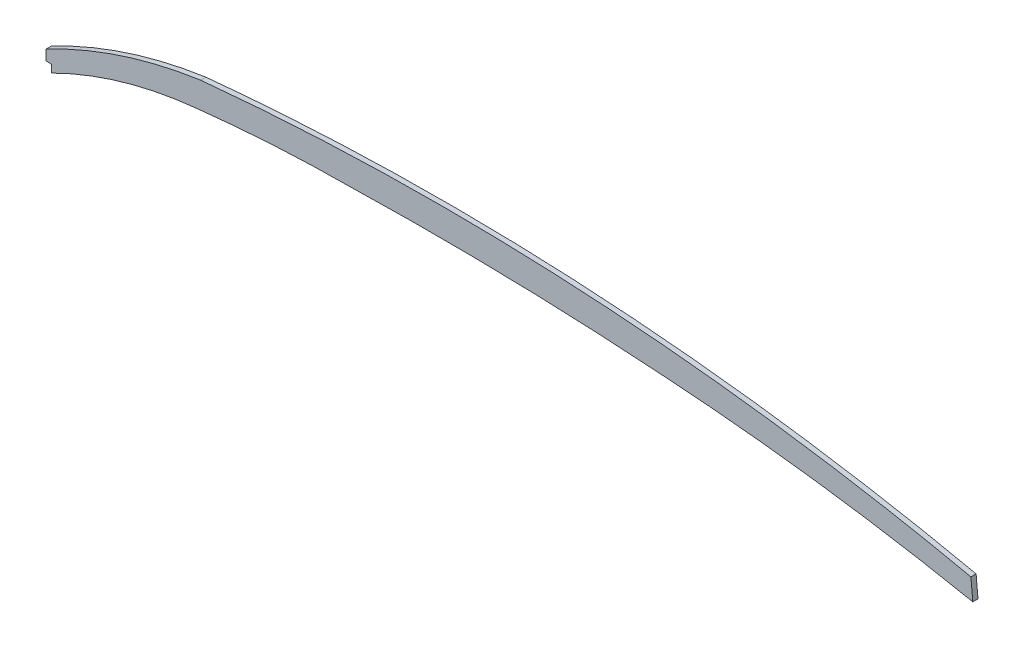
from build123d import *

# Parameters (mm, degrees)
BOSS_EXTRUDE1_DEPTH = 1.5875
SKETCH2_W           = 3.3528
SKETCH2_H           = 6.4262
CUT_EXTRUDE1_DEPTH  = 583.351362494


with BuildPart() as part:
    # Sketch1 → Boss-Extrude1 (new, symmetric)
    with BuildSketch(Plane.XY):
        with BuildLine():
            Line((0, 98.650251409), (0, 85.942482804))
            ThreePointArc((0, 85.942482804), (44.883725347, 104.075777355), (92.3925, 113.364561093))
            ThreePointArc((92.3925, 113.364561093), (139.073495573, 117.280297245), (185.895946704, 118.731643998))
            ThreePointArc((185.895946704, 118.731643998), (279.546572247, 118.92726657), (373.101055052, 114.68030529))
            ThreePointArc((373.101055052, 114.68030529), (470.024153779, 105.277769076), (566.085246422, 89.31652744))
            Line((566.085246422, 89.31652744), (564.932089986, 101.967475673))
            add(Edge.make_bspline(
                [(564.932089986, 101.967475673), (526.305455218, 110.35905311), (487.405693808, 117.234860687), (438.439550099, 123.934721128), (428.624759847, 125.180263294), (408.998984047, 127.476820047), (399.18472115, 128.528373058), (369.737829992, 131.394440576), (350.101100844, 132.920474645), (291.174630327, 136.353130053), (251.868630305, 137.116022476), (173.213311456, 135.594508668), (133.863993721, 133.310179259), (94.492645692, 129.476109839)],
                knots=[0, 0, 0, 0, 0.25, 0.25, 0.3125, 0.3125, 0.375, 0.375, 0.5, 0.5, 0.75, 0.75, 1, 1, 1, 1], degree=3))
            ThreePointArc((94.492645692, 129.476109839), (45.925545315, 118.111851759), (0, 98.650251409))
        make_face()
    extrude(amount=BOSS_EXTRUDE1_DEPTH, both=True)

    # Sketch2 → Cut-Extrude1 (cut, through all)
    with BuildSketch(Plane.XY.offset(1.5875)):
        with Locations((1.6764, 89.155582804)):
            Rectangle(SKETCH2_W, SKETCH2_H)
    extrude(amount=-CUT_EXTRUDE1_DEPTH, mode=Mode.SUBTRACT)


solid = part.part
